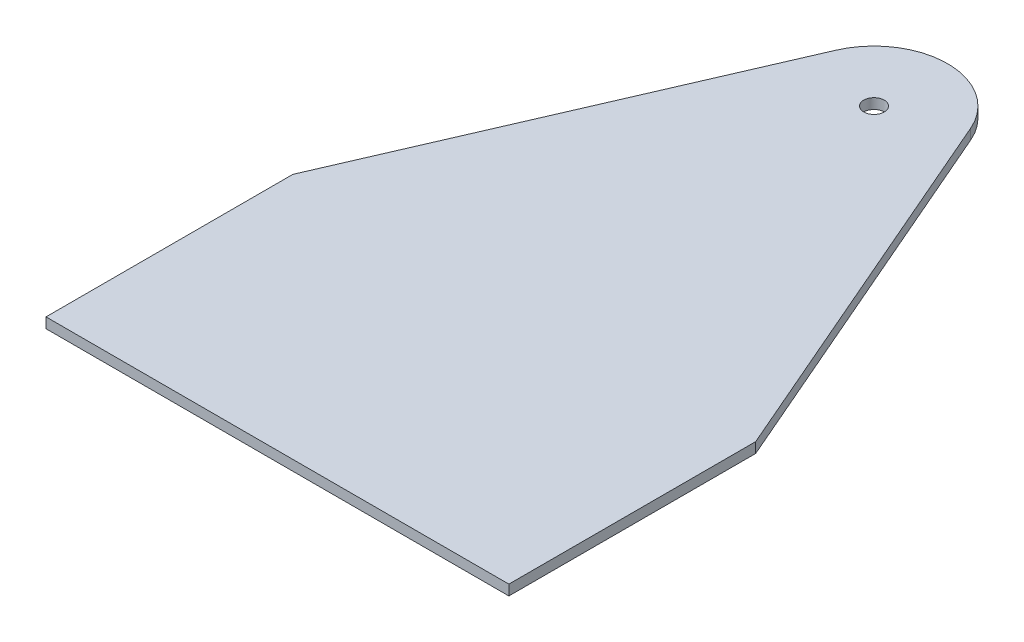
from build123d import *

# Parameters (mm, degrees)
SKETCH1_R           = 3.175
BOSS_EXTRUDE1_DEPTH = 3.175


with BuildPart() as part:
    # Sketch1 → Boss-Extrude1 (new body)
    with BuildSketch(Plane(origin=(0, 0, 0), x_dir=(1, 0, 0), z_dir=(0, 1, 0))):
        with BuildLine():
            Line((-71.4375, 0), (71.4375, 0))
            Line((71.4375, 0), (71.4375, 76.2))
            Line((71.4375, 76.2), (20.828751655, 193.16244062))
            ThreePointArc((20.828751655, 193.16244062), (0, 206.844954977), (-20.828751655, 193.16244062))
            Line((-20.828751655, 193.16244062), (-71.4375, 76.2))
            Line((-71.4375, 76.2), (-71.4375, 0))
        make_face()
        with Locations((0, 184.15)):
            Circle(SKETCH1_R, mode=Mode.SUBTRACT)
    extrude(amount=BOSS_EXTRUDE1_DEPTH)


solid = part.part
